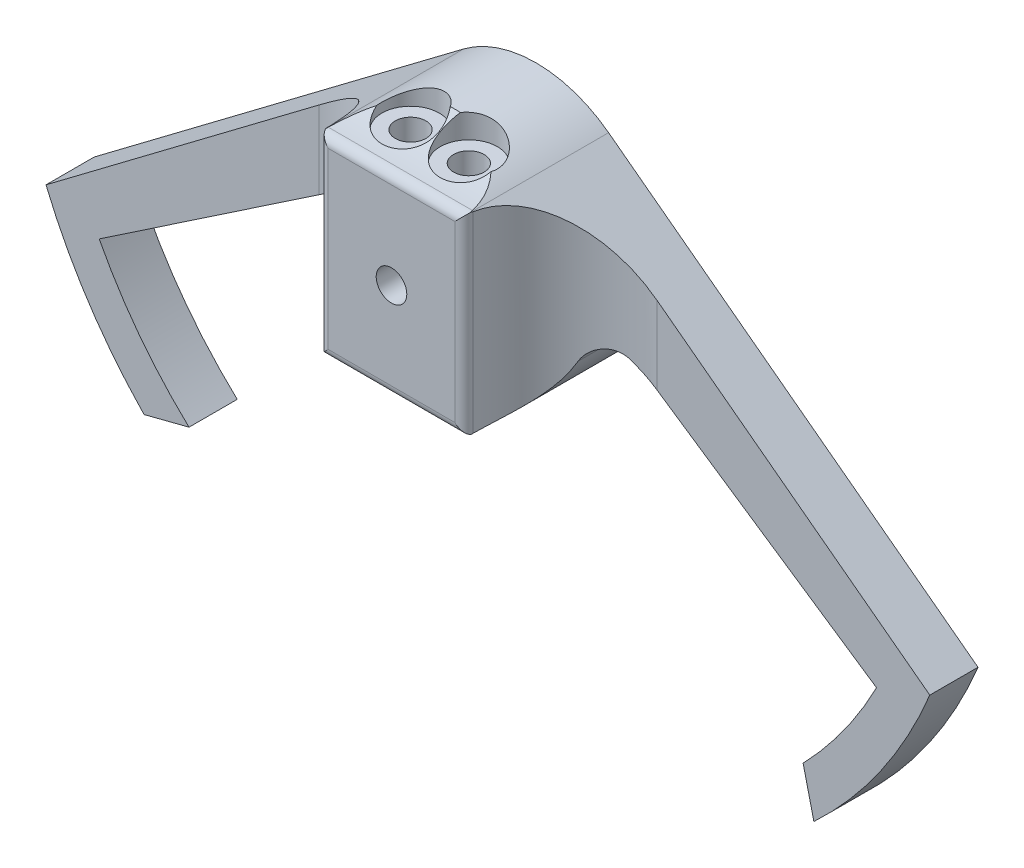
from build123d import *

# Parameters (mm, degrees)
SKETCH1_R               = 25
BOSS_EXTRUDE1_DEPTH     = 10
SKETCH2_W               = 30.085094154
SKETCH2_H               = 39.936037732
BOSS_EXTRUDE2_DEPTH     = 20
FILLET1_R               = 20
CUT_EXTRUDE1_DEPTH      = 134.62547488
CUT_EXTRUDE1_DEPTH_BACK = 134.62547488
SKETCH3_R               = 3.175
FILLET3_R               = 20
FILLET5_R               = 20
SKETCH4_R               = 5.953125
CUT_EXTRUDE2_DEPTH      = 31
FILLET7_R               = 5
FILLET9_R               = 2
SKETCH5_R               = 3.175
CUT_EXTRUDE3_DEPTH      = 121.671113768


with BuildPart() as part:
    # Sketch1 → Boss-Extrude1 (new body)
    with BuildSketch(Plane.XY):
        Circle(SKETCH1_R)
        with BuildLine():
            ThreePointArc((-24.643084336, -4.209322322), (-23.235173593, 9.22641361), (-15.042547077, 19.968018866))
            Line((-15.042547077, 19.968018866), (-91.676973156, -37.763144638))
            ThreePointArc((-91.676973156, -37.763144638), (-82.974943001, -54.275973819), (-71.332297316, -68.865273249))
            Line((-71.332297316, -68.865273249), (-62.003067816, -66.471268842))
            ThreePointArc((-62.003067816, -66.471268842), (-72.363508125, -55.012114046), (-80.633906414, -41.964069588))
            Line((-80.633906414, -41.964069588), (-24.643084336, -4.209322322))
        make_face()
        with BuildLine():
            Line((91.676973156, -37.763144638), (15.042547077, 19.968018866))
            ThreePointArc((15.042547077, 19.968018866), (22.372568884, 11.156529995), (25, 0))
            ThreePointArc((25, 0), (24.910611277, -2.112213484), (24.643084336, -4.209322322))
            Line((24.643084336, -4.209322322), (80.633906414, -41.964069588))
            ThreePointArc((80.633906414, -41.964069588), (73.778760224, -53.099006957), (65.396932184, -63.135182434))
            Line((65.396932184, -63.135182434), (67.630408954, -72.504139776))
            ThreePointArc((67.630408954, -72.504139776), (81.525730199, -56.429405592), (91.676973156, -37.763144638))
        make_face()
    extrude(amount=BOSS_EXTRUDE1_DEPTH)

    # Sketch2 → Boss-Extrude2 (add)
    with BuildSketch(Plane.XY.offset(10)):
        Rectangle(SKETCH2_W, SKETCH2_H)
    extrude(amount=BOSS_EXTRUDE2_DEPTH)

    # Fillet1
    # the kernel refuses this fillet: 20 mm, written as the material it adds along each edge
    with BuildSketch(Plane(origin=(-15.042547077, -69.968018866, 10), x_dir=(-1, 0, 0), z_dir=(0, 1, 0))) as fillet1_piece_1_section:
        with BuildLine():
            CenterArc((FILLET1_R, FILLET1_R), FILLET1_R, 180, 90)
            Line((0, FILLET1_R), (0, 0))
            Line((0, 0), (FILLET1_R, 0))
        make_face()
    fillet1_piece_1 = extrude(amount=139.936037732, mode=Mode.PRIVATE)
    fillet1_piece_1 = fillet1_piece_1 & Plane(origin=(0, 0, 15.558695302), x_dir=(1, 0, 0), z_dir=(0, 0, -1)) * Cylinder(25, 360, mode=Mode.PRIVATE)
    add(fillet1_piece_1)
    with BuildSketch(Plane(origin=(-15.042547077, -69.968018866, 10), x_dir=(-1, 0, 0), z_dir=(0, 1, 0))) as fillet1_piece_2_section:
        with BuildLine():
            CenterArc((FILLET1_R, FILLET1_R), FILLET1_R, 180, 90)
            Line((0, FILLET1_R), (0, 0))
            Line((0, 0), (FILLET1_R, 0))
        make_face()
    fillet1_piece_2 = extrude(amount=139.936037732, mode=Mode.PRIVATE)
    fillet1_piece_2 = split(fillet1_piece_2, bisect_by=Plane(origin=(-20.320077545, -1.294308347, 11.459171074), z_dir=(-0.5590754570924006, 0.8291167790347289, 0)), keep=Keep.TOP, mode=Mode.PRIVATE)
    fillet1_piece_2 = split(fillet1_piece_2, bisect_by=Plane(origin=(-28.248761809, 10.019355048, 11.459171074), z_dir=(0.6017018830767349, -0.798720754645772, 0)), keep=Keep.TOP, mode=Mode.PRIVATE)
    add(fillet1_piece_2)
    with BuildSketch(Plane(origin=(15.042547077, 69.968018866, 10), x_dir=(1, 0, 0), z_dir=(0, -1, 0))) as fillet1_piece_3_section:
        with BuildLine():
            CenterArc((FILLET1_R, FILLET1_R), FILLET1_R, 180, 90)
            Line((0, FILLET1_R), (0, 0))
            Line((0, 0), (FILLET1_R, 0))
        make_face()
    fillet1_piece_3 = extrude(amount=139.936037732, mode=Mode.PRIVATE)
    fillet1_piece_3 = split(fillet1_piece_3, bisect_by=Plane(origin=(14.459810809, 2.657283741, 15.104352505), z_dir=(0.5590754570924011, 0.8291167790347287, 0)), keep=Keep.TOP, mode=Mode.PRIVATE)
    fillet1_piece_3 = split(fillet1_piece_3, bisect_by=Plane(origin=(22.70483943, 14.195769039, 15.104352505), z_dir=(-0.6017018830767359, -0.7987207546457712, 0)), keep=Keep.TOP, mode=Mode.PRIVATE)
    add(fillet1_piece_3)
    with BuildSketch(Plane(origin=(15.042547077, 69.968018866, 10), x_dir=(1, 0, 0), z_dir=(0, -1, 0))) as fillet1_piece_4_section:
        with BuildLine():
            CenterArc((FILLET1_R, FILLET1_R), FILLET1_R, 180, 90)
            Line((0, FILLET1_R), (0, 0))
            Line((0, 0), (FILLET1_R, 0))
        make_face()
    fillet1_piece_4 = extrude(amount=139.936037732, mode=Mode.PRIVATE)
    fillet1_piece_4 = fillet1_piece_4 & Plane(origin=(0, 0, 15.558690215), x_dir=(1, 0, 0), z_dir=(0, 0, -1)) * Cylinder(25, 360, mode=Mode.PRIVATE)
    add(fillet1_piece_4)

    # Sketch3 → Cut-Extrude1 (cut, two sides: drawn at the far end of the back side and taken through both)
    with BuildSketch(Plane(origin=(0, 19.968018866, 0), x_dir=(1, 0, 0), z_dir=(0, 1, 0)).offset(-CUT_EXTRUDE1_DEPTH_BACK)):
        with Locations(Location((-6.042547077, -20, 0), (0, 0, 270))):
            Circle(SKETCH3_R)
        with Locations(Location((6.042547077, -20, 0), (0, 0, 270))):
            Circle(SKETCH3_R)
    extrude(amount=CUT_EXTRUDE1_DEPTH + CUT_EXTRUDE1_DEPTH_BACK, mode=Mode.SUBTRACT)

    # Fillet3
    # the kernel refuses this fillet: 20 mm, written as the material it adds along each edge
    with BuildSketch(Plane(origin=(65.042547077, -19.968018866, 10), x_dir=(0, 0, 1), z_dir=(-1, 0, 0))) as fillet3_piece_1_section:
        with BuildLine():
            CenterArc((FILLET3_R, -FILLET3_R), FILLET3_R, 90, 90)
            Line((0, -FILLET3_R), (0, 0))
            Line((0, 0), (FILLET3_R, 0))
        make_face()
    fillet3_piece_1 = extrude(amount=130.085094154, mode=Mode.PRIVATE)
    fillet3_piece_1 = fillet3_piece_1 & Plane(origin=(0, 0, 16.291006277), x_dir=(1, 0, 0), z_dir=(0, 0, -1)) * Cylinder(25, 341, mode=Mode.PRIVATE)
    fillet3_piece_1 = fillet3_piece_1 - Plane(origin=(6.042547077, -21.38078464, 20), x_dir=(0, 0, 1), z_dir=(0, 1, 0)) * Cylinder(3.175, 341, mode=Mode.PRIVATE)
    fillet3_piece_1 = fillet3_piece_1 - Plane(origin=(-6.042547077, -21.38078464, 20), x_dir=(0, 0, 1), z_dir=(0, 1, 0)) * Cylinder(3.175, 341, mode=Mode.PRIVATE)
    add(fillet3_piece_1)

    # Fillet5
    # the kernel refuses this fillet: 20 mm, written as the material it adds along each edge
    with BuildSketch(Plane(origin=(-65.042547077, 19.968018866, 10), x_dir=(0, 1, 0), z_dir=(1, 0, 0))) as fillet5_piece_1_section:
        with BuildLine():
            CenterArc((FILLET5_R, FILLET5_R), FILLET5_R, 180, 90)
            Line((0, FILLET5_R), (0, 0))
            Line((0, 0), (FILLET5_R, 0))
        make_face()
    fillet5_piece_1 = extrude(amount=130.085094154, mode=Mode.PRIVATE)
    fillet5_piece_1 = fillet5_piece_1 & Plane(origin=(0, 0, 15.801111539), x_dir=(1, 0, 0), z_dir=(0, 0, -1)) * Cylinder(25, 341, mode=Mode.PRIVATE)
    fillet5_piece_1 = fillet5_piece_1 - Plane(origin=(-6.042547077, 21.701320861, 20), x_dir=(0, 0, 1), z_dir=(0, 1, 0)) * Cylinder(3.175, 341, mode=Mode.PRIVATE)
    fillet5_piece_1 = fillet5_piece_1 - Plane(origin=(6.042547077, 21.701320861, 20), x_dir=(0, 0, 1), z_dir=(0, 1, 0)) * Cylinder(3.175, 341, mode=Mode.PRIVATE)
    add(fillet5_piece_1)

    # Sketch4 → Cut-Extrude2 (cut)
    with BuildSketch(Plane(origin=(0, 19.968018866, 0), x_dir=(1, 0, 0), z_dir=(0, 1, 0))):
        with Locations(Location((6.042547077, -20, 0), (0, 0, 147.025587644))):
            Circle(SKETCH4_R)
        with Locations(Location((-6.042547077, -20, 0), (0, 0, 32.974415101))):
            Circle(SKETCH4_R)
    extrude(amount=CUT_EXTRUDE2_DEPTH, mode=Mode.SUBTRACT)

    # Fillet7
    # the kernel refuses this fillet: 5 mm, written as the material it adds along each edge
    with BuildSketch(Plane(origin=(24.643084336, -4.209322322, 0), x_dir=(0.8291167790354833, -0.5590754570912817, -6.249516371214043e-11), z_dir=(7.202413204596011e-11, -4.970254555305837e-12, 1.0))) as fillet7_piece_1_section:
        with BuildLine():
            CenterArc((6.745071106, -5), FILLET7_R, 90, 100.151066862)
            ThreePointArc((1.82333867, -5.881220646), (1.093425598, -2.884260928), (0, 0))
            Line((0, 0), (6.745071106, 0))
        make_face()
    fillet7_piece_1 = extrude(amount=29.779025501, mode=Mode.PRIVATE)
    fillet7_piece_1 = fillet7_piece_1 - Plane(origin=(35.042547077, -6.555500108, 30), x_dir=(1, 0, 0), z_dir=(0, 1, 0)) * Cylinder(20, 87, mode=Mode.PRIVATE)
    add(fillet7_piece_1)
    with BuildSketch(Plane(origin=(-24.643084336, -4.209322322, 0), x_dir=(0.28848075474664325, -0.957485693961433, -5.3876835639154796e-11), z_dir=(-6.385338562061998e-10, -2.4865286856013713e-10, 1.0))) as fillet7_piece_2_section:
        with BuildLine():
            CenterArc((6.773117261, -4.961941837), FILLET7_R, 97.073793797, 100.151066862)
            Line((1.997367439, -6.442554427), (0, 0))
            ThreePointArc((0, 0), (3.078689664, -0.190290813), (6.157379328, 0))
        make_face()
    fillet7_piece_2 = extrude(amount=29.779025492, mode=Mode.PRIVATE)
    fillet7_piece_2 = fillet7_piece_2 - Plane(origin=(-35.042547077, -6.555494729, 30), x_dir=(-1, 0, 0), z_dir=(0, -1, 0)) * Cylinder(20, 86, mode=Mode.PRIVATE)
    add(fillet7_piece_2)

    # Fillet9
    # the kernel refuses this fillet: 2 mm, written as the material it takes off along each edge
    with BuildSketch(Plane(origin=(19.814802827, -19.968018866, 30), x_dir=(0, -0.04550167324429649, -0.9989642624898898), z_dir=(-1, 0, 0))) as fillet9_piece_1:
        with BuildLine():
            CenterArc((1.911070276, -1.997928525), FILLET9_R, 92.607954285, 84.78409143)
            Line((-0.086858249, -1.906925178), (0, 0))
            ThreePointArc((0, 0), (0.910033465, -0.02071475), (1.82006693, 0))
        make_face()
    extrude(amount=39.629605655, mode=Mode.SUBTRACT)
    with BuildSketch(Plane(origin=(15.042547077, 2.264343261, 30), x_dir=(0.04550167324409409, 0, -0.998964262489899), z_dir=(0, -1, 0))) as fillet9_piece_2:
        with BuildLine():
            CenterArc((1.911070276, -1.997928525), FILLET9_R, 92.607954285, 84.78409143)
            Line((-0.086858249, -1.906925178), (0, 0))
            ThreePointArc((0, 0), (0.910033465, -0.02071475), (1.82006693, 0))
        make_face()
    extrude(amount=27.004617877, mode=Mode.SUBTRACT)
    with BuildSketch(Plane(origin=(-19.814802827, 19.968018866, 30), x_dir=(0, -1, 0), z_dir=(1, 0, 0))) as fillet9_piece_3:
        with BuildLine():
            CenterArc((1.9089023, 2), FILLET9_R, 185.21590857, 84.78409143)
            ThreePointArc((-0.082816091, 1.818181818), (-0.02071475, 0.910033465), (0, 0))
            Line((0, 0), (1.9089023, 0))
        make_face()
    extrude(amount=39.629605655, mode=Mode.SUBTRACT)
    with BuildSketch(Plane(origin=(-15.042547077, -24.740274617, 30), x_dir=(-0.04550167324429658, 0, -0.9989642624898897), z_dir=(0, 1, 0))) as fillet9_piece_4:
        with BuildLine():
            CenterArc((1.911070276, -1.997928525), FILLET9_R, 92.607954285, 84.78409143)
            Line((-0.086858249, -1.906925178), (0, 0))
            ThreePointArc((0, 0), (0.910033465, -0.02071475), (1.82006693, 0))
        make_face()
    extrude(amount=49.480549233, mode=Mode.SUBTRACT)
    with BuildSketch(Plane(origin=(15.042547077, 24.740274617, 30), x_dir=(-1, 0, 0), z_dir=(0, -1, 0))) as fillet9_piece_5:
        with BuildLine():
            CenterArc((1.9089023, 2), FILLET9_R, 185.21590857, 84.78409143)
            ThreePointArc((-0.082816091, 1.818181818), (-0.02071475, 0.910033465), (0, 0))
            Line((0, 0), (1.9089023, 0))
        make_face()
    extrude(amount=22.475931356, mode=Mode.SUBTRACT)

    # Sketch5 → Cut-Extrude3 (cut, through all)
    with BuildSketch(Plane.XY.offset(30)):
        Circle(SKETCH5_R)
    extrude(amount=-CUT_EXTRUDE3_DEPTH, mode=Mode.SUBTRACT)


solid = part.part
